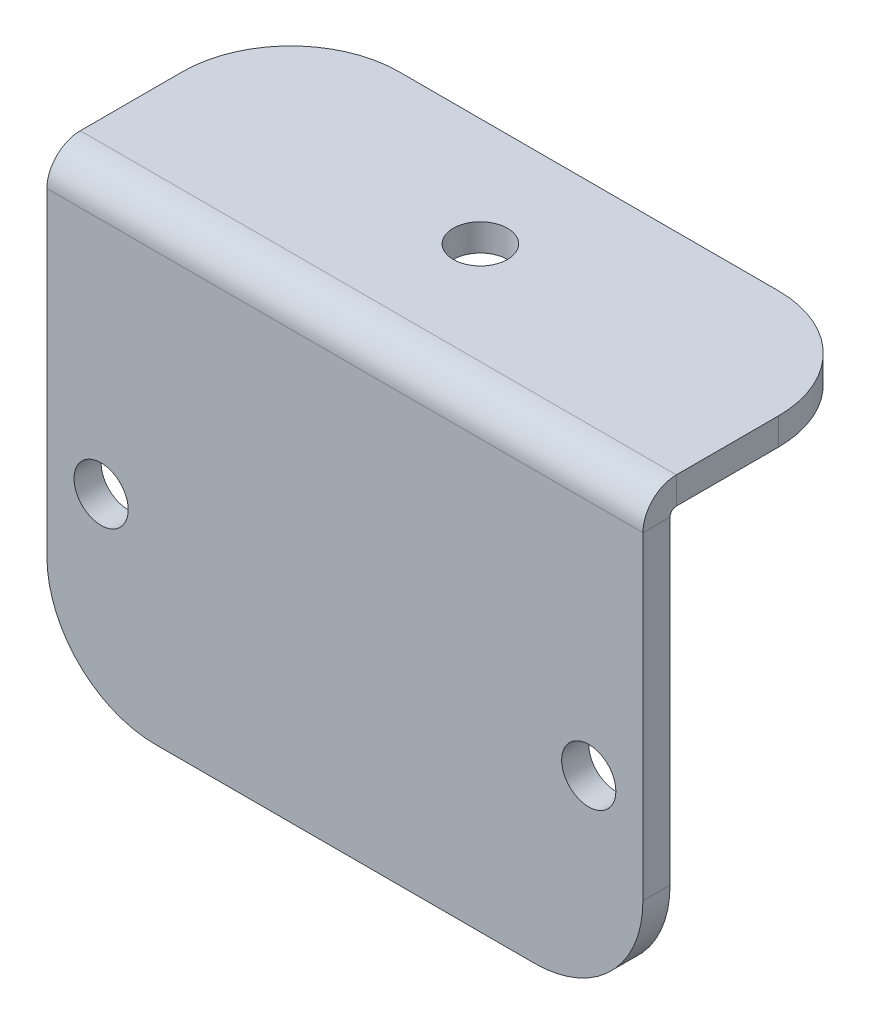
from build123d import *

# Parameters (mm, degrees)
BASE_FLANGE1_DEPTH = 34.925
SKETCH6_R          = 3.175
CUT_EXTRUDE1_DEPTH = 68.947967225
FILLET1_R          = 12.7
SKETCH7_R          = 3.175
CUT_EXTRUDE2_DEPTH = 70.124642856


# Sheet-metal steps are written as plain solids
with BuildPart() as part:
    # Sketch1 → Base-Flange1 (new, symmetric)
    with BuildSketch(Plane(origin=(0, 0, 0), x_dir=(0, 0, -1), z_dir=(1, 0, 0))):
        with BuildLine():
            Line((25.4, 0), (0.7366, 0))
            ThreePointArc((0.7366, 0), (0.215745145, -0.215745145), (0, -0.7366))
            Line((0, -0.7366), (0, -50.8))
            Line((0, -50.8), (-3.175, -50.8))
            Line((-3.175, -50.8), (-3.175, -0.7366))
            ThreePointArc((-3.175, -0.7366), (-2.029318885, 2.029318885), (0.7366, 3.175))
            Line((0.7366, 3.175), (25.4, 3.175))
            Line((25.4, 3.175), (25.4, 0))
        make_face()
    extrude(amount=BASE_FLANGE1_DEPTH, both=True)

    # Sketch6 → Cut-Extrude1 (cut, through all)
    with BuildSketch(Plane.XY.offset(3.175)):
        with Locations((-28.575, -28.575)):
            Circle(SKETCH6_R)
        with Locations((28.575, -28.575)):
            Circle(SKETCH6_R)
    extrude(amount=-CUT_EXTRUDE1_DEPTH, mode=Mode.SUBTRACT)

    # Fillet1
    fillet1_edges = [part.edges().sort_by_distance(p)[0] for p in [
        (34.925, 1.5875, -25.4),
        (34.925, -50.8, 1.5875),
        (-34.925, 1.5875, -25.4),
        (-34.925, -50.8, 1.5875),
    ]]
    fillet(fillet1_edges, radius=FILLET1_R)

    # Sketch7 → Cut-Extrude2 (cut, through all)
    with BuildSketch(Plane(origin=(0, 3.175, 0), x_dir=(1, 0, 0), z_dir=(0, 1, 0))):
        with Locations(Location((0, 12.7, 0), (0, 0, 270))):
            Circle(SKETCH7_R)
    extrude(amount=-CUT_EXTRUDE2_DEPTH, mode=Mode.SUBTRACT)


solid = part.part
